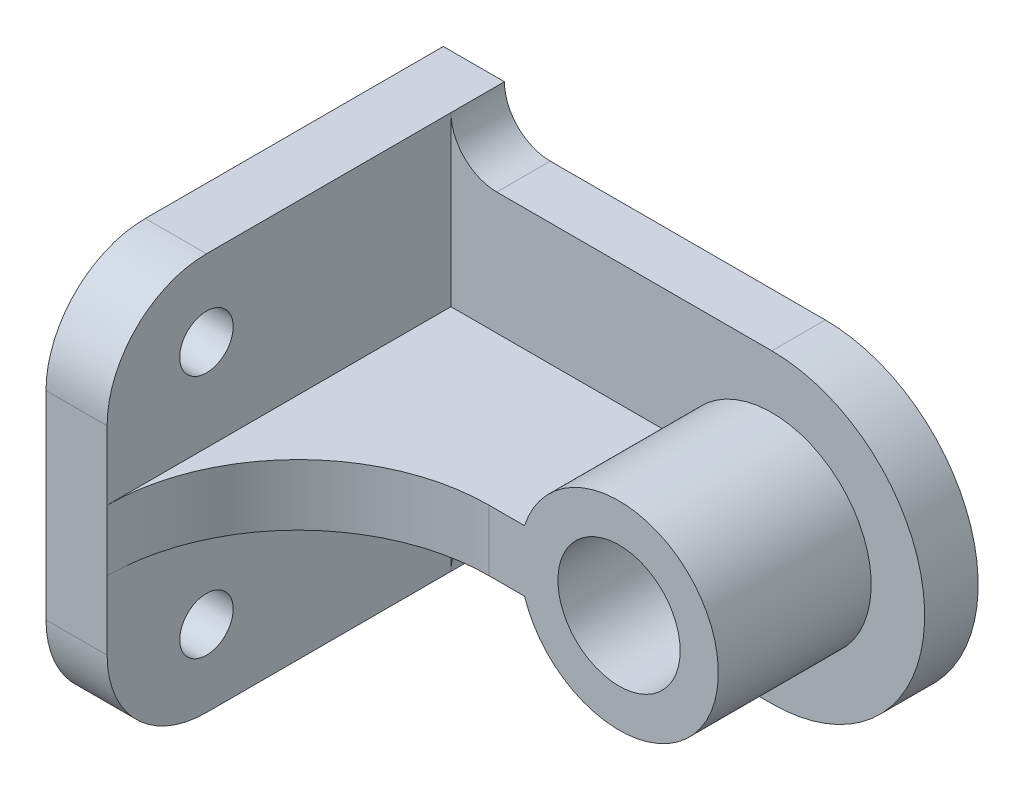
from build123d import *
from OCP.BRepFilletAPI import BRepFilletAPI_MakeFillet

# Parameters (mm, degrees)
SKETCH1_W                  = 8
SKETCH1_H                  = 52
BOSS_EXTRUDE1_DEPTH        = 52
BOSS_EXTRUDE2_DEPTH        = 7
SKETCH1_4_R                = 13
SKETCH1_4_R_2              = 8
BOSS_EXTRUDE3_DEPTH        = 27
FILLET1_R                  = 25
FILLET1_R_2                = 6
FILLET1_R_3                = 13
F_12_0MM_DOWEL_HOLE1_D     = 7
F_12_0MM_DOWEL_HOLE1_DEPTH = 30
F_12_0MM_DOWEL_HOLE1_TIP   = 2.103012167


with BuildPart() as part:
    # Sketch1 → Boss-Extrude1 (new body)
    with BuildSketch(Plane.XY):
        with Locations((-4, 0)):
            Rectangle(SKETCH1_W, SKETCH1_H)
    extrude(amount=BOSS_EXTRUDE1_DEPTH)

    # Sketch1<3> → Boss-Extrude2 (add)
    with BuildSketch(Plane.XY):
        with BuildLine():
            Line((42, 20), (0, 20))
            Line((0, 20), (0, 4))
            Line((0, 4), (29.630683123, 4))
            ThreePointArc((29.630683123, 4), (44.02470746, 12.841361287), (55, 0))
            ThreePointArc((55, 0), (44.02470746, -12.841361287), (29.630683123, -4))
            Line((29.630683123, -4), (0, -4))
            Line((0, -4), (0, -20))
            Line((0, -20), (42, -20))
            ThreePointArc((42, -20), (62, 0), (42, 20))
        make_face()
    extrude(amount=BOSS_EXTRUDE2_DEPTH)

    # Sketch1<4> → Boss-Extrude3 (add)
    # profile 1 of 2: a face of its own
    with BuildSketch(Plane.XY):
        with Locations((42, 0)):
            Circle(SKETCH1_4_R)
        with Locations((42, 0)):
            Circle(SKETCH1_4_R_2, mode=Mode.SUBTRACT)
    # profile 2 of 2: a face of its own
    with BuildSketch(Plane.XY):
        with BuildLine():
            Line((29.630683123, 4), (0, 4))
            Line((0, 4), (0, -4))
            Line((0, -4), (29.630683123, -4))
            ThreePointArc((29.630683123, -4), (29, 0), (29.630683123, 4))
        make_face()
    extrude(amount=BOSS_EXTRUDE3_DEPTH)

    # Fillet1
    fillet1_edges_1 = [part.edges().sort_by_distance(p)[0] for p in [
        (0, 0, 27),
    ]]
    fillet1_edges_2 = [part.edges().sort_by_distance(p)[0] for p in [
        (0, -20, 3.5),
        (0, 20, 3.5),
    ]]
    fillet1 = BRepFilletAPI_MakeFillet(part.part.solid().wrapped)
    for e in fillet1_edges_1:
        fillet1.Add(FILLET1_R - 0.0001, e.wrapped)
    for e in fillet1_edges_2:
        fillet1.Add(FILLET1_R_2 - 0.0001, e.wrapped)
    add(Compound.cast(fillet1.Shape()), mode=Mode.REPLACE)  # a hair under: the kernel refuses the full size
    fillet1_2_edges = [part.edges().sort_by_distance(p)[0] for p in [
        (-4, -26, 52),
        (-4, 26, 52),
    ]]
    fillet(fillet1_2_edges, radius=FILLET1_R_3)

    # Ø12.0mm Dowel Hole1
    with Locations(Plane(origin=(0, 16, 39), x_dir=(0, 1, 0), z_dir=(1, 0, 0))):
        with Locations((0, 0), (-32, 0)):
            Hole(F_12_0MM_DOWEL_HOLE1_D / 2, depth=F_12_0MM_DOWEL_HOLE1_DEPTH)
            with Locations((0, 0, -(F_12_0MM_DOWEL_HOLE1_DEPTH + F_12_0MM_DOWEL_HOLE1_TIP / 2))):  # 118° drill point
                Cone(0, F_12_0MM_DOWEL_HOLE1_D / 2, F_12_0MM_DOWEL_HOLE1_TIP, mode=Mode.SUBTRACT)


solid = part.part
